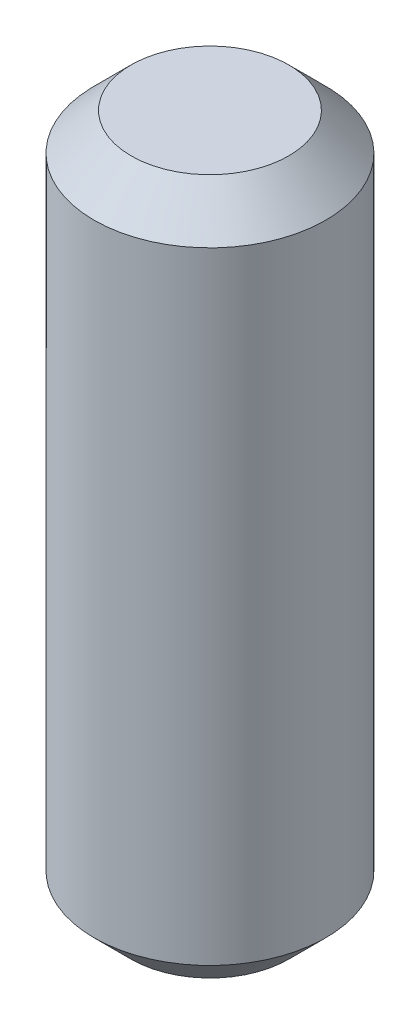
from build123d import *

# Parameters (mm, degrees)
SKETCH1_R           = 2.5
BOSS_EXTRUDE1_DEPTH = 15
CHAMFER1_SIZE       = 0.8


with BuildPart() as part:
    # Sketch1 → Boss-Extrude1 (new body)
    with BuildSketch(Plane(origin=(0, 0, 0), x_dir=(1, 0, 0), z_dir=(0, 1, 0))):
        Circle(SKETCH1_R)
    extrude(amount=BOSS_EXTRUDE1_DEPTH)

    # Chamfer1
    chamfer1_edges = [part.edges().sort_by_distance(p)[0] for p in [
        (-2.5, 0, 0),
        (-2.5, 15, 0),
    ]]
    chamfer(chamfer1_edges, length=CHAMFER1_SIZE)


solid = part.part
